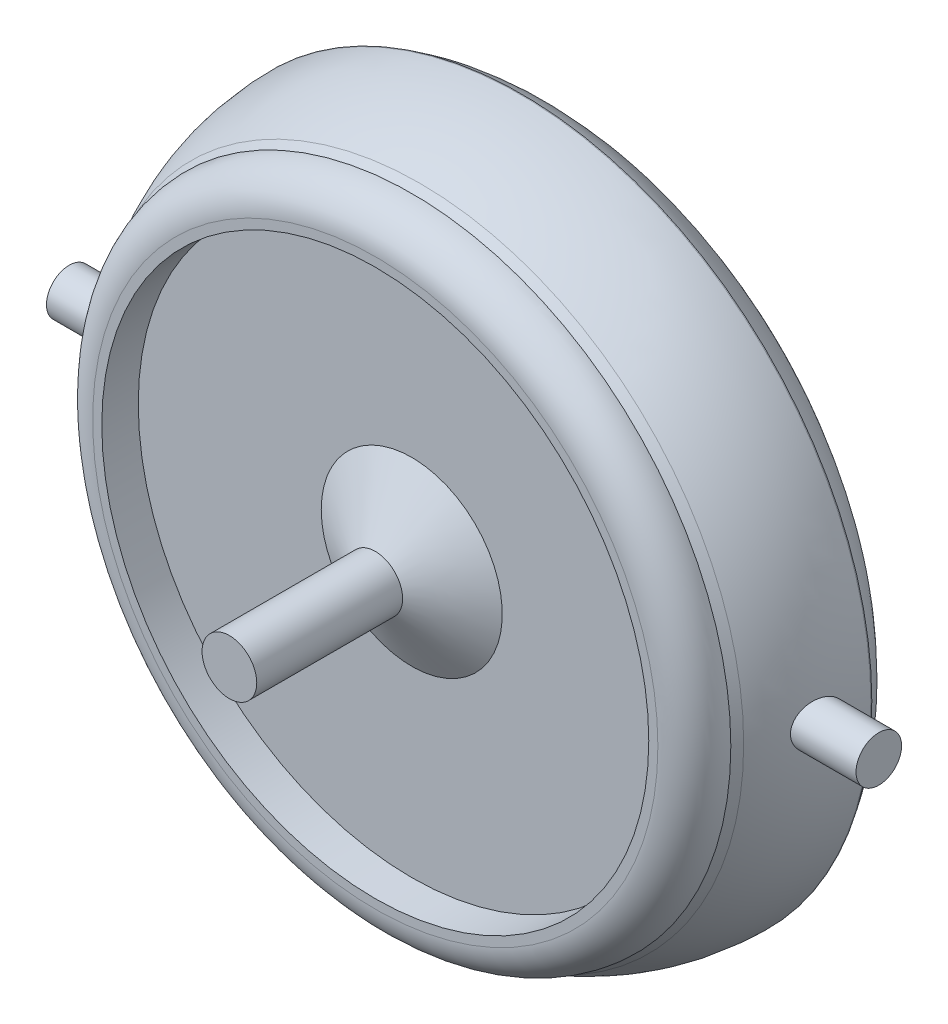
from build123d import *

# Parameters (mm, degrees)
SKETCH1_R                = 15
BOSS_EXTRUDE1_DEPTH      = 80
SKETCH2_R                = 15
BOSS_EXTRUDE2_DEPTH      = 20
BOSS_EXTRUDE2_DRAFT      = -60
SKETCH3_R                = 175
BOSS_EXTRUDE5_DEPTH      = 30
BOSS_EXTRUDE5_DRAFT      = -30
SKETCH6_R                = 175
SKETCH6_R_2              = 150
BOSS_EXTRUDE6_DEPTH      = 20
SKETCH7_R                = 192.320508076
BOSS_EXTRUDE7_DEPTH      = 30
SKETCH9_R                = 192.320508076
BOSS_EXTRUDE8_DEPTH      = 30
BOSS_EXTRUDE8_TAPER      = 30
FILLET2_R                = 60
FILLET3_R                = 110
FILLET4_R                = 20
BOSS_EXTRUDE9_DEPTH      = 30
BOSS_EXTRUDE9_DEPTH_BACK = 414
SKETCH10_R               = 12.5


with BuildPart() as part:
    # Sketch1 → Boss-Extrude1 (new body)
    with BuildSketch(Plane.XY):
        Circle(SKETCH1_R)
    extrude(amount=BOSS_EXTRUDE1_DEPTH)


with BuildPart() as boss_extrude2_tool:
    # Sketch2 → Boss-Extrude2 (with draft: the straight prism first)
    with BuildSketch(Plane(origin=(0, 0, 0), x_dir=(-1, 0, 0), z_dir=(0, 0, -1))):
        Circle(SKETCH2_R)
    extrude(amount=BOSS_EXTRUDE2_DEPTH)
    # Boss-Extrude2: the draft: its side faces are tilted about the plane it starts from
    boss_extrude2_sides = [boss_extrude2_tool.faces().sort_by_distance(p)[0] for p in [
        (15, 0, -10),
    ]]
    draft(boss_extrude2_sides, Plane(origin=(0, 0, 0), x_dir=(-1, 0, 0), z_dir=(0, 0, -1)), BOSS_EXTRUDE2_DRAFT)


with BuildPart() as part_1:
    add(part.part)

    # Boss-Extrude2: add boss_extrude2_tool
    add(boss_extrude2_tool.part)


with BuildPart() as boss_extrude5_tool:
    # Sketch3 → Boss-Extrude5 (with draft: the straight prism first)
    with BuildSketch(Plane(origin=(0, 0, -20), x_dir=(-1, 0, 0), z_dir=(0, 0, -1))):
        Circle(SKETCH3_R)
    extrude(amount=BOSS_EXTRUDE5_DEPTH)
    # Boss-Extrude5: the draft: its side faces are tilted about the plane it starts from
    boss_extrude5_sides = [boss_extrude5_tool.faces().sort_by_distance(p)[0] for p in [
        (175, 0, -35),
    ]]
    draft(boss_extrude5_sides, Plane(origin=(0, 0, -20), x_dir=(-1, 0, 0), z_dir=(0, 0, -1)), BOSS_EXTRUDE5_DRAFT)


with BuildPart() as part_2:
    add(part_1.part)

    # Boss-Extrude5: add boss_extrude5_tool
    add(boss_extrude5_tool.part)

    # Sketch6 → Boss-Extrude6 (add)
    with BuildSketch(Plane.XY.offset(-20)):
        Circle(SKETCH6_R)
        Circle(SKETCH6_R_2, mode=Mode.SUBTRACT)
    extrude(amount=BOSS_EXTRUDE6_DEPTH)

    # Sketch7 → Boss-Extrude7 (add)
    with BuildSketch(Plane(origin=(0, 0, -50), x_dir=(-1, 0, 0), z_dir=(0, 0, -1))):
        Circle(SKETCH7_R)
    extrude(amount=BOSS_EXTRUDE7_DEPTH)

    # Sketch9 → Boss-Extrude8 (add)
    with BuildSketch(Plane(origin=(0, 0, -80), x_dir=(-1, 0, 0), z_dir=(0, 0, -1))):
        Circle(SKETCH9_R)
    extrude(amount=BOSS_EXTRUDE8_DEPTH, taper=BOSS_EXTRUDE8_TAPER)

    # Fillet2
    fillet2_edges = [part_2.edges().sort_by_distance(p)[0] for p in [
        (175, 0, -110),
    ]]
    fillet(fillet2_edges, radius=FILLET2_R - 0.0001)  # a hair under: the kernel refuses the full size

    # Fillet3
    fillet3_edges = [part_2.edges().sort_by_distance(p)[0] for p in [
        (192.320508076, 0, -50),
    ]]
    fillet(fillet3_edges, radius=FILLET3_R)

    # Fillet4
    fillet4_edges = [part_2.edges().sort_by_distance(p)[0] for p in [
        (-175, 0, 0),
    ]]
    fillet(fillet4_edges, radius=FILLET4_R - 0.0001)  # a hair under: the kernel refuses the full size

    # Sketch10 → Boss-Extrude9 (add, two sides: drawn at the far end of the back side and taken through both)
    with BuildSketch(Plane.ZY.offset(192.320508076).offset(-BOSS_EXTRUDE9_DEPTH_BACK)):
        with Locations((-54.474411167, 0)):
            Circle(SKETCH10_R)
    extrude(amount=BOSS_EXTRUDE9_DEPTH + BOSS_EXTRUDE9_DEPTH_BACK)


solid = part_2.part
